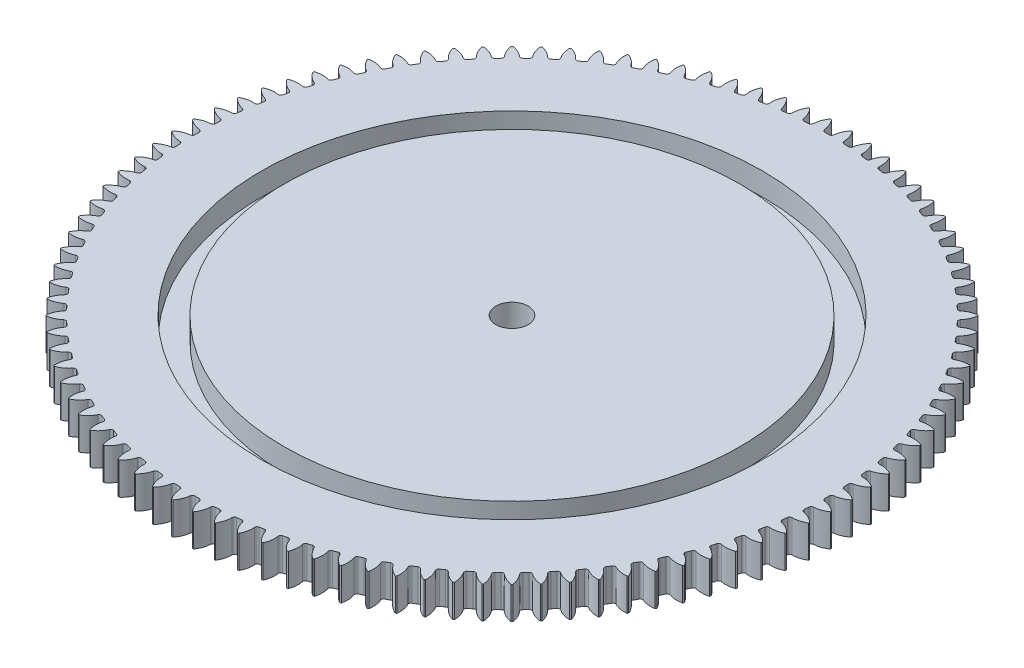
from build123d import *

# Parameters (mm, degrees)
SKETCH1_R                = 102
SKETCH1_R_2              = 5
BOSS_EXTRUDE1_DEPTH      = 10
CUT_EXTRUDE1_DEPTH       = 145.595988879
FILLET1_R                = 0.76
CIRPATTERN2_COUNT        = 100
FILLET1_OF_CIRPATTERN2_R = 0.76
SKETCH3_R                = 77.5
SKETCH3_R_2              = 70.5
CUT_EXTRUDE2_DEPTH       = 7


with BuildPart() as part:
    # Sketch1 → Boss-Extrude1 (new body)
    with BuildSketch(Plane(origin=(0, 0, 0), x_dir=(1, 0, 0), z_dir=(0, 1, 0))):
        with Locations(Location((0, 0, 0), (0, 0, 270))):
            Circle(SKETCH1_R)
        with Locations(Location((0, 0, 0), (0, 0, 270))):
            Circle(SKETCH1_R_2, mode=Mode.SUBTRACT)
    extrude(amount=BOSS_EXTRUDE1_DEPTH)

    # Sketch2 → Cut-Extrude1 (cut, through all)
    with BuildSketch(Plane(origin=(0, 10, 0), x_dir=(1, 0, 0), z_dir=(0, 1, 0))):
        with BuildLine():
            ThreePointArc((1.389546622, 97.490097755), (0, 97.5), (-1.389546622, 97.490097755))
            ThreePointArc((-1.389546622, 97.490097755), (-1.824876583, 99.860091271), (-3.014796953, 101.95543634))
            ThreePointArc((-3.014796953, 101.95543634), (0, 102), (3.014796953, 101.95543634))
            ThreePointArc((3.014796953, 101.95543634), (1.824876583, 99.860091271), (1.389546622, 97.490097755))
        make_face()
    cut_extrude1 = extrude(amount=-CUT_EXTRUDE1_DEPTH, mode=Mode.SUBTRACT)

    # Fillet1
    fillet1_edges = [part.edges().sort_by_distance(p)[0] for p in [
        (-1.389546622, 5, -97.490097755),
        (1.389546622, 5, -97.490097755),
    ]]
    fillet(fillet1_edges, radius=FILLET1_R)

    # CirPattern2: Cut-Extrude1 ×100 about axis
    cirpattern2_axis = Axis((0, 0, 0), (0, 1, 0))
    for i in range(1, CIRPATTERN2_COUNT):
        add(cut_extrude1.rotate(cirpattern2_axis, i * 360 / CIRPATTERN2_COUNT), mode=Mode.SUBTRACT)

    # Fillet1 of CirPattern2
    fillet1_of_cirpattern2_edges = [part.edges().sort_by_distance(p)[0] for p in [
        (-7.508258556, 5, -97.210472962),
        (-4.734649218, 5, -97.38497367),
        (-13.597338824, 5, -96.547202844),
        (-10.840159561, 5, -96.895515586),
        (-19.632756607, 5, -95.502905024),
        (-16.902888746, 5, -96.023655169),
        (-25.59069287, 5, -94.081700869),
        (-22.898909951, 5, -94.772833254),
        (-31.447634359, 5, -92.289199223),
        (-28.80455962, 5, -93.147986264),
        (-37.180466402, 5, -90.132474271),
        (-34.596530852, 5, -91.155526728),
        (-42.766564131, 5, -87.62003762),
        (-40.251965383, 5, -88.803317972),
        (-48.183881769, 5, -84.76180471),
        (-45.748543795, 5, -86.100643091),
        (-53.411039638, 5, -81.569055681),
        (-51.064573605, 5, -83.058168307),
        (-58.427408536, 5, -78.054390855),
        (-56.179074873, 5, -79.687900878),
        (-63.213191145, 5, -74.231681008),
        (-61.071862998, 5, -76.003141711),
        (-67.749500168, 5, -70.116012629),
        (-65.723628381, 5, -72.018432866),
        (-72.018432866, 5, -65.723628381),
        (-70.116012629, 5, -67.749500168),
        (-76.003141711, 5, -61.071862998),
        (-74.231681008, 5, -63.213191145),
        (-79.687900878, 5, -56.179074873),
        (-78.054390855, 5, -58.427408536),
        (-83.058168307, 5, -51.064573605),
        (-81.569055681, 5, -53.411039638),
        (-86.100643091, 5, -45.748543795),
        (-84.76180471, 5, -48.183881769),
        (-88.803317972, 5, -40.251965383),
        (-87.62003762, 5, -42.766564131),
        (-91.155526728, 5, -34.596530852),
        (-90.132474271, 5, -37.180466402),
        (-93.147986264, 5, -28.80455962),
        (-92.289199223, 5, -31.447634359),
        (-94.772833254, 5, -22.898909951),
        (-94.081700869, 5, -25.59069287),
        (-96.023655169, 5, -16.902888746),
        (-95.502905024, 5, -19.632756607),
        (-96.895515586, 5, -10.840159561),
        (-96.547202844, 5, -13.597338824),
        (-97.38497367, 5, -4.734649218),
        (-97.210472962, 5, -7.508258556),
        (-97.490097755, 5, 1.389546622),
        (-97.490097755, 5, -1.389546622),
        (-97.210472962, 5, 7.508258556),
        (-97.38497367, 5, 4.734649218),
        (-96.547202844, 5, 13.597338824),
        (-96.895515586, 5, 10.840159561),
        (-95.502905024, 5, 19.632756607),
        (-96.023655169, 5, 16.902888746),
        (-94.081700869, 5, 25.59069287),
        (-94.772833254, 5, 22.898909951),
        (-92.289199223, 5, 31.447634359),
        (-93.147986264, 5, 28.80455962),
        (-90.132474271, 5, 37.180466402),
        (-91.155526728, 5, 34.596530852),
        (-87.62003762, 5, 42.766564131),
        (-88.803317972, 5, 40.251965383),
        (-84.76180471, 5, 48.183881769),
        (-86.100643091, 5, 45.748543795),
        (-81.569055681, 5, 53.411039638),
        (-83.058168307, 5, 51.064573605),
        (-78.054390855, 5, 58.427408536),
        (-79.687900878, 5, 56.179074873),
        (-74.231681008, 5, 63.213191145),
        (-76.003141711, 5, 61.071862998),
        (-70.116012629, 5, 67.749500168),
        (-72.018432866, 5, 65.723628381),
        (-65.723628381, 5, 72.018432866),
        (-67.749500168, 5, 70.116012629),
        (-61.071862998, 5, 76.003141711),
        (-63.213191145, 5, 74.231681008),
        (-56.179074873, 5, 79.687900878),
        (-58.427408536, 5, 78.054390855),
        (-51.064573605, 5, 83.058168307),
        (-53.411039638, 5, 81.569055681),
        (-45.748543795, 5, 86.100643091),
        (-48.183881769, 5, 84.76180471),
        (-40.251965383, 5, 88.803317972),
        (-42.766564131, 5, 87.62003762),
        (-34.596530852, 5, 91.155526728),
        (-37.180466402, 5, 90.132474271),
        (-28.80455962, 5, 93.147986264),
        (-31.447634359, 5, 92.289199223),
        (-22.898909951, 5, 94.772833254),
        (-25.59069287, 5, 94.081700869),
        (-16.902888746, 5, 96.023655169),
        (-19.632756607, 5, 95.502905024),
        (-10.840159561, 5, 96.895515586),
        (-13.597338824, 5, 96.547202844),
        (-4.734649218, 5, 97.38497367),
        (-7.508258556, 5, 97.210472962),
        (1.389546622, 5, 97.490097755),
        (-1.389546622, 5, 97.490097755),
        (7.508258556, 5, 97.210472962),
        (4.734649218, 5, 97.38497367),
        (13.597338824, 5, 96.547202844),
        (10.840159561, 5, 96.895515586),
        (19.632756607, 5, 95.502905024),
        (16.902888746, 5, 96.023655169),
        (25.59069287, 5, 94.081700869),
        (22.898909951, 5, 94.772833254),
        (31.447634359, 5, 92.289199223),
        (28.80455962, 5, 93.147986264),
        (37.180466402, 5, 90.132474271),
        (34.596530852, 5, 91.155526728),
        (42.766564131, 5, 87.62003762),
        (40.251965383, 5, 88.803317972),
        (48.183881769, 5, 84.76180471),
        (45.748543795, 5, 86.100643091),
        (53.411039638, 5, 81.569055681),
        (51.064573605, 5, 83.058168307),
        (58.427408536, 5, 78.054390855),
        (56.179074873, 5, 79.687900878),
        (63.213191145, 5, 74.231681008),
        (61.071862998, 5, 76.003141711),
        (67.749500168, 5, 70.116012629),
        (65.723628381, 5, 72.018432866),
        (72.018432866, 5, 65.723628381),
        (70.116012629, 5, 67.749500168),
        (76.003141711, 5, 61.071862998),
        (74.231681008, 5, 63.213191145),
        (79.687900878, 5, 56.179074873),
        (78.054390855, 5, 58.427408536),
        (83.058168307, 5, 51.064573605),
        (81.569055681, 5, 53.411039638),
        (86.100643091, 5, 45.748543795),
        (84.76180471, 5, 48.183881769),
        (88.803317972, 5, 40.251965383),
        (87.62003762, 5, 42.766564131),
        (91.155526728, 5, 34.596530852),
        (90.132474271, 5, 37.180466402),
        (93.147986264, 5, 28.80455962),
        (92.289199223, 5, 31.447634359),
        (94.772833254, 5, 22.898909951),
        (94.081700869, 5, 25.59069287),
        (96.023655169, 5, 16.902888746),
        (95.502905024, 5, 19.632756607),
        (96.895515586, 5, 10.840159561),
        (96.547202844, 5, 13.597338824),
        (97.38497367, 5, 4.734649218),
        (97.210472962, 5, 7.508258556),
        (97.490097755, 5, -1.389546622),
        (97.490097755, 5, 1.389546622),
        (97.210472962, 5, -7.508258556),
        (97.38497367, 5, -4.734649218),
        (96.547202844, 5, -13.597338824),
        (96.895515586, 5, -10.840159561),
        (95.502905024, 5, -19.632756607),
        (96.023655169, 5, -16.902888746),
        (94.081700869, 5, -25.59069287),
        (94.772833254, 5, -22.898909951),
        (92.289199223, 5, -31.447634359),
        (93.147986264, 5, -28.80455962),
        (90.132474271, 5, -37.180466402),
        (91.155526728, 5, -34.596530852),
        (87.62003762, 5, -42.766564131),
        (88.803317972, 5, -40.251965383),
        (84.76180471, 5, -48.183881769),
        (86.100643091, 5, -45.748543795),
        (81.569055681, 5, -53.411039638),
        (83.058168307, 5, -51.064573605),
        (78.054390855, 5, -58.427408536),
        (79.687900878, 5, -56.179074873),
        (74.231681008, 5, -63.213191145),
        (76.003141711, 5, -61.071862998),
        (70.116012629, 5, -67.749500168),
        (72.018432866, 5, -65.723628381),
        (65.723628381, 5, -72.018432866),
        (67.749500168, 5, -70.116012629),
        (61.071862998, 5, -76.003141711),
        (63.213191145, 5, -74.231681008),
        (56.179074873, 5, -79.687900878),
        (58.427408536, 5, -78.054390855),
        (51.064573605, 5, -83.058168307),
        (53.411039638, 5, -81.569055681),
        (45.748543795, 5, -86.100643091),
        (48.183881769, 5, -84.76180471),
        (40.251965383, 5, -88.803317972),
        (42.766564131, 5, -87.62003762),
        (34.596530852, 5, -91.155526728),
        (37.180466402, 5, -90.132474271),
        (28.80455962, 5, -93.147986264),
        (31.447634359, 5, -92.289199223),
        (22.898909951, 5, -94.772833254),
        (25.59069287, 5, -94.081700869),
        (16.902888746, 5, -96.023655169),
        (19.632756607, 5, -95.502905024),
        (10.840159561, 5, -96.895515586),
        (13.597338824, 5, -96.547202844),
        (4.734649218, 5, -97.38497367),
        (7.508258556, 5, -97.210472962),
    ]]
    fillet(fillet1_of_cirpattern2_edges, radius=FILLET1_OF_CIRPATTERN2_R)

    # Sketch3 → Cut-Extrude2 (cut)
    with BuildSketch(Plane(origin=(0, 10, 0), x_dir=(1, 0, 0), z_dir=(0, 1, 0))):
        with Locations(Location((0, 0, 0), (0, 0, 270))):
            Circle(SKETCH3_R)
        with Locations(Location((0, 0, 0), (0, 0, 270))):
            Circle(SKETCH3_R_2, mode=Mode.SUBTRACT)
    extrude(amount=-CUT_EXTRUDE2_DEPTH, mode=Mode.SUBTRACT)


solid = part.part
